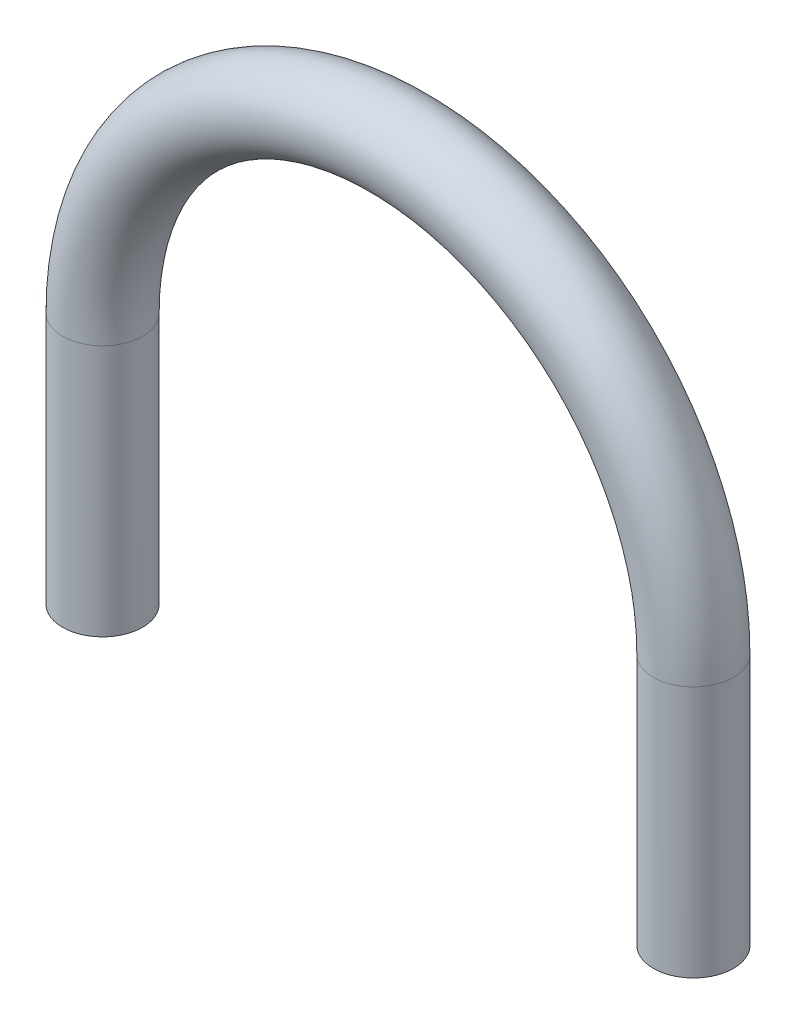
from build123d import *

# Parameters (mm, degrees)
BALAYAGE3_PROFILE_R = 3.175


with BuildPart() as part:
    # Balayage3: sweep along a path in Esquisse1
    with BuildLine(Plane.XY) as balayage3_path:
        Line((-23.44, -20), (-23.44, 0))
        ThreePointArc((-23.44, 0), (0, 23.44), (23.44, 0))
        Line((23.44, 0), (23.44, -20))
    # Balayage3 profile (on start of the path) → Balayage3 (sweep)
    with BuildSketch(Plane(origin=(-23.44, -20, 0), x_dir=(0, 0, 1), z_dir=(0, 1, 0))):
        Circle(BALAYAGE3_PROFILE_R)
    sweep(path=balayage3_path.line)


solid = part.part
